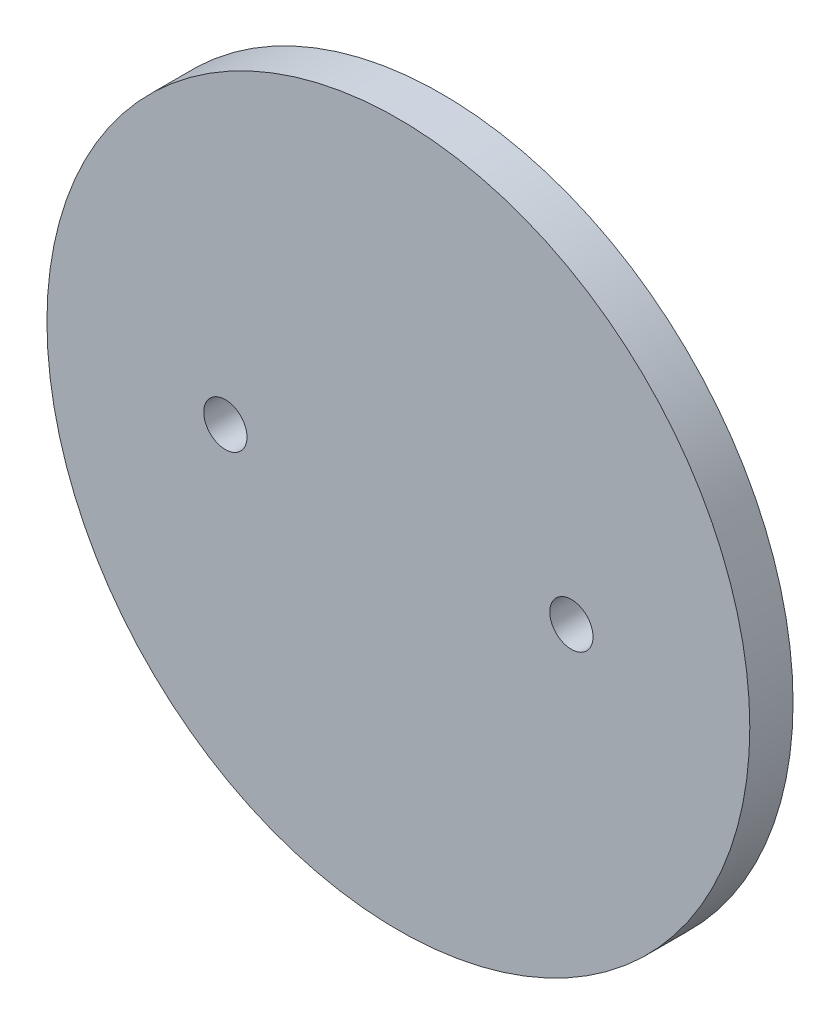
from build123d import *

# Parameters (mm, degrees)
SKETCH1_R           = 20.6375
BOSS_EXTRUDE1_DEPTH = 2.54
SKETCH2_R           = 1.27
CUT_EXTRUDE1_DEPTH  = 30.296150131


with BuildPart() as part:
    # Sketch1 → Boss-Extrude1 (new body)
    with BuildSketch(Plane.XY):
        Circle(SKETCH1_R)
    extrude(amount=BOSS_EXTRUDE1_DEPTH)

    # Sketch2 → Cut-Extrude1 (cut, through all)
    with BuildSketch(Plane.XY.offset(2.54)):
        with Locations((-10.16, 0)):
            Circle(SKETCH2_R)
        with Locations((10.16, 0)):
            Circle(SKETCH2_R)
    extrude(amount=-CUT_EXTRUDE1_DEPTH, mode=Mode.SUBTRACT)


solid = part.part
